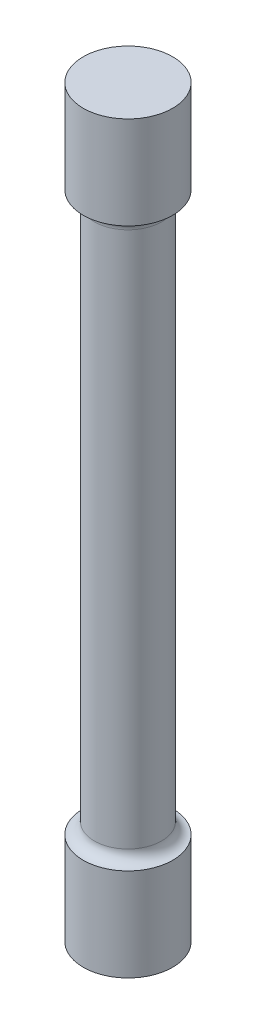
from build123d import *

# Parameters (mm, degrees)
CROQUIS1_R                 = 2
SALIENTE_EXTRUIR1_DEPTH    = 16.65
CORTAR_EXTRUIR1_DEPTH      = 12.5
CORTAR_EXTRUIR1_DEPTH_BACK = 12.5
CROQUIS2_R                 = 2
CROQUIS2_R_2               = 1.505
REDONDEO1_R                = 0.5
REDONDEO2_R                = 0.5


with BuildPart() as part:
    # Croquis1 → Saliente-Extruir1 (new, symmetric)
    with BuildSketch(Plane(origin=(0, 0, 0), x_dir=(1, 0, 0), z_dir=(0, 1, 0))):
        with Locations(Location((0, 0, 0), (0, 0, 270))):
            Circle(CROQUIS1_R)
    extrude(amount=SALIENTE_EXTRUIR1_DEPTH, both=True)

    # Croquis2 → Cortar-Extruir1 (cut, two sides: drawn at the far end of the back side and taken through both)
    with BuildSketch(Plane(origin=(0, 0, 0), x_dir=(1, 0, 0), z_dir=(0, 1, 0)).offset(-CORTAR_EXTRUIR1_DEPTH_BACK)):
        with Locations(Location((0, 0, 0), (0, 0, 270))):
            Circle(CROQUIS2_R)
        with Locations(Location((0, 0, 0), (0, 0, 270))):
            Circle(CROQUIS2_R_2, mode=Mode.SUBTRACT)
    extrude(amount=CORTAR_EXTRUIR1_DEPTH + CORTAR_EXTRUIR1_DEPTH_BACK, mode=Mode.SUBTRACT)

    # Redondeo1
    # the kernel refuses this fillet: 0.5 mm, written as the material it adds along each edge
    with BuildSketch(Plane(origin=(0, -12.5, 0), x_dir=(0, 0, 1), z_dir=(-1, 0, 0))) as redondeo1_piece_1_section:
        with BuildLine():
            CenterArc((1.505 + REDONDEO1_R, REDONDEO1_R), REDONDEO1_R, 180, 90)
            Line((1.505, REDONDEO1_R), (1.505, 0))
            Line((1.505, 0), (1.505 + REDONDEO1_R, 0))
        make_face()
    redondeo1_piece_1 = revolve(axis=Axis((0, -12.5, 0), (0, 1, 0)), mode=Mode.PRIVATE)
    redondeo1_piece_1 = redondeo1_piece_1 & Plane(origin=(0, -12.357868044, 0), x_dir=(0, 0, 1), z_dir=(0, 1, 0)) * Cylinder(2, 9, mode=Mode.PRIVATE)
    add(redondeo1_piece_1)

    # Redondeo2
    # the kernel refuses this fillet: 0.5 mm, written as the material it adds along each edge
    with BuildSketch(Plane(origin=(0, 12.5, 0), x_dir=(0, 0, 1), z_dir=(-1, 0, 0))) as redondeo2_piece_1_section:
        with BuildLine():
            CenterArc((1.505 + REDONDEO2_R, -REDONDEO2_R), REDONDEO2_R, 90, 90)
            Line((1.505 + REDONDEO2_R, 0), (1.505, 0))
            Line((1.505, 0), (1.505, -REDONDEO2_R))
        make_face()
    redondeo2_piece_1 = revolve(axis=Axis((0, 12.5, 0), (0, 1, 0)), mode=Mode.PRIVATE)
    redondeo2_piece_1 = redondeo2_piece_1 & Plane(origin=(0, 12.357868044, 0), x_dir=(0, 0, 1), z_dir=(0, 1, 0)) * Cylinder(2, 9, mode=Mode.PRIVATE)
    add(redondeo2_piece_1)


solid = part.part
